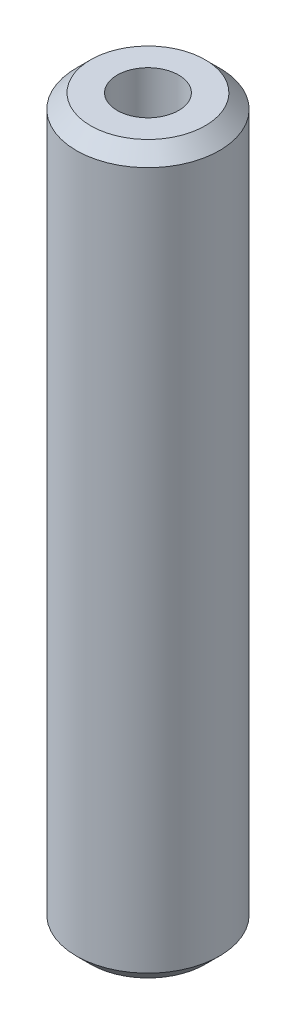
from build123d import *

# Parameters (mm, degrees)
SKETCH1_R           = 25
BOSS_EXTRUDE1_DEPTH = 253.670663537
SKETCH2_R           = 10.735949164
CUT_EXTRUDE1_DEPTH  = 257.122637694
CHAMFER1_SIZE       = 4.997637333


with BuildPart() as part:
    # Sketch1 → Boss-Extrude1 (new body)
    with BuildSketch(Plane(origin=(0, 0, 0), x_dir=(1, 0, 0), z_dir=(0, 1, 0))):
        Circle(SKETCH1_R)
    extrude(amount=BOSS_EXTRUDE1_DEPTH)

    # Sketch2 → Cut-Extrude1 (cut, through all)
    with BuildSketch(Plane(origin=(0, 0, 0), x_dir=(1, 0, 0), z_dir=(0, 1, 0))):
        Circle(SKETCH2_R)
    extrude(amount=CUT_EXTRUDE1_DEPTH, mode=Mode.SUBTRACT)

    # Chamfer1
    chamfer1_edges = [part.edges().sort_by_distance(p)[0] for p in [
        (-25, 253.670663537, 0),
        (-25, 0, 0),
    ]]
    chamfer(chamfer1_edges, length=CHAMFER1_SIZE)


solid = part.part
